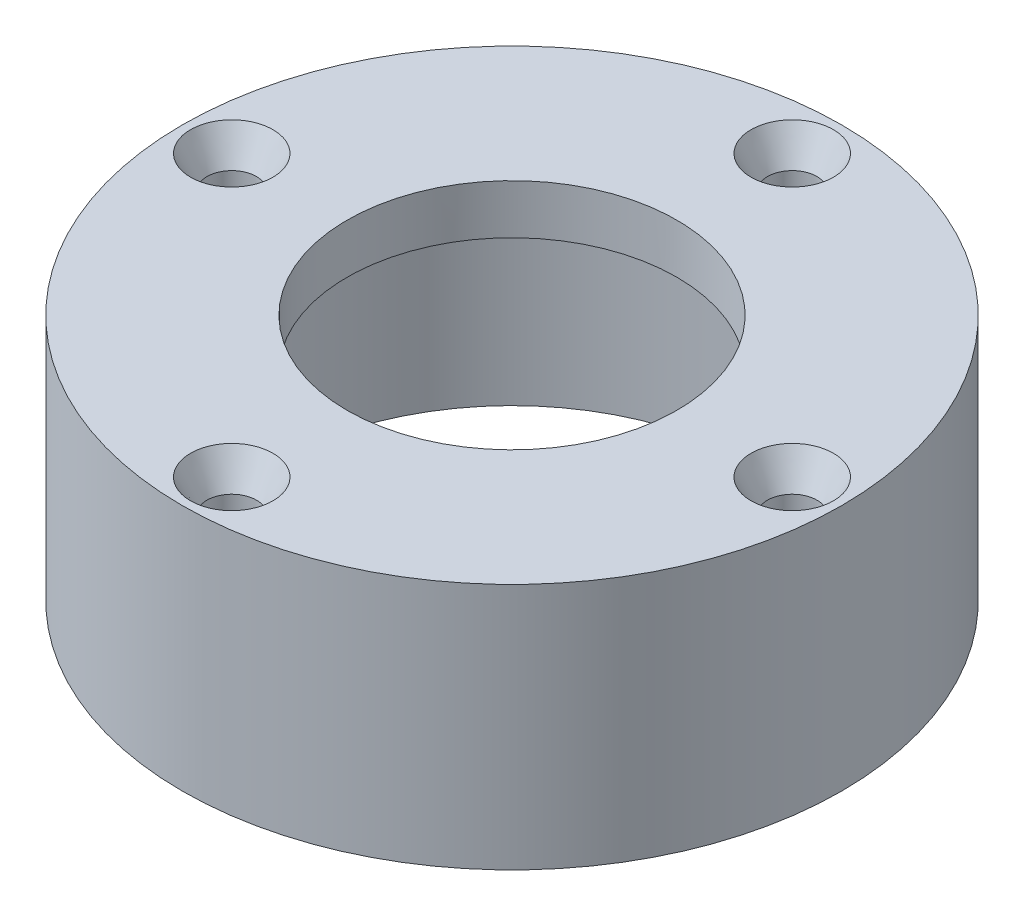
from build123d import *

# Parameters (mm, degrees)
SKETCH1_R                    = 20
BOSS_EXTRUDE1_DEPTH          = 15
SKETCH4_R                    = 14.5
CUT_EXTRUDE3_DEPTH           = 12
SKETCH5_R                    = 10
CUT_EXTRUDE4_DEPTH           = 12
SKETCH6_R                    = 1.5
CUT_EXTRUDE5_DEPTH           = 33.015621187
SKETCH7_R                    = 2.5
CUT_EXTRUDE7_DEPTH           = 2
CUT_EXTRUDE7_DRAFT           = -27
CUT_EXTRUDE7_PROFILE_2_DEPTH = 2
CUT_EXTRUDE7_PROFILE_2_DRAFT = -27
CUT_EXTRUDE7_PROFILE_3_DEPTH = 2
CUT_EXTRUDE7_PROFILE_3_DRAFT = -27
CUT_EXTRUDE7_PROFILE_4_DEPTH = 2
CUT_EXTRUDE7_PROFILE_4_DRAFT = -27


with BuildPart() as part:
    # Sketch1 → Boss-Extrude1 (new body)
    with BuildSketch(Plane(origin=(0, 0, 0), x_dir=(1, 0, 0), z_dir=(0, 1, 0))):
        Circle(SKETCH1_R)
    extrude(amount=BOSS_EXTRUDE1_DEPTH)

    # Sketch4 → Cut-Extrude3 (cut)
    with BuildSketch(Plane.XZ):
        Circle(SKETCH4_R)
    extrude(amount=-CUT_EXTRUDE3_DEPTH, mode=Mode.SUBTRACT)

    # Sketch5 → Cut-Extrude4 (cut)
    with BuildSketch(Plane(origin=(0, 15, 0), x_dir=(1, 0, 0), z_dir=(0, 1, 0))):
        Circle(SKETCH5_R)
    extrude(amount=-CUT_EXTRUDE4_DEPTH, mode=Mode.SUBTRACT)

    # Sketch6 → Cut-Extrude5 (cut, through all)
    with BuildSketch(Plane(origin=(0, 15, 0), x_dir=(1, 0, 0), z_dir=(0, 1, 0))):
        with Locations((0, 17)):
            Circle(SKETCH6_R)
        with Locations((17, 0)):
            Circle(SKETCH6_R)
        with Locations((0, -17)):
            Circle(SKETCH6_R)
        with Locations((-17, 0)):
            Circle(SKETCH6_R)
    extrude(amount=-CUT_EXTRUDE5_DEPTH, mode=Mode.SUBTRACT)


with BuildPart() as cut_extrude7_tool:
    # Sketch7 → Cut-Extrude7 (with draft: the straight prism first)
    with BuildSketch(Plane(origin=(0, 15, 0), x_dir=(1, 0, 0), z_dir=(0, 1, 0))):
        with Locations((0, 17)):
            Circle(SKETCH7_R)
    extrude(amount=-CUT_EXTRUDE7_DEPTH)
    # Cut-Extrude7: the draft: its side faces are tilted about the plane it starts from
    cut_extrude7_sides = [cut_extrude7_tool.faces().sort_by_distance(p)[0] for p in [
        (-2.5, 14, -17),
    ]]
    draft(cut_extrude7_sides, Plane(origin=(0, 15, 0), x_dir=(1, 0, 0), z_dir=(0, 1, 0)), CUT_EXTRUDE7_DRAFT)


with BuildPart() as part_1:
    add(part.part)

    # Cut-Extrude7: cut by cut_extrude7_tool
    add(cut_extrude7_tool.part, mode=Mode.SUBTRACT)


with BuildPart() as cut_extrude7_profile_2_tool:
    # Sketch7 → Cut-Extrude7 profile 2 (with draft: the straight prism first)
    with BuildSketch(Plane(origin=(0, 15, 0), x_dir=(1, 0, 0), z_dir=(0, 1, 0))):
        with Locations((17, 0)):
            Circle(SKETCH7_R)
    extrude(amount=-CUT_EXTRUDE7_PROFILE_2_DEPTH)
    # Cut-Extrude7 profile 2: the draft: its side faces are tilted about the plane it starts from
    cut_extrude7_profile_2_sides = [cut_extrude7_profile_2_tool.faces().sort_by_distance(p)[0] for p in [
        (14.5, 14, 0),
    ]]
    draft(cut_extrude7_profile_2_sides, Plane(origin=(0, 15, 0), x_dir=(1, 0, 0), z_dir=(0, 1, 0)), CUT_EXTRUDE7_PROFILE_2_DRAFT)


with BuildPart() as part_2:
    add(part_1.part)

    # Cut-Extrude7 profile 2: cut by cut_extrude7_profile_2_tool
    add(cut_extrude7_profile_2_tool.part, mode=Mode.SUBTRACT)


with BuildPart() as cut_extrude7_profile_3_tool:
    # Sketch7 → Cut-Extrude7 profile 3 (with draft: the straight prism first)
    with BuildSketch(Plane(origin=(0, 15, 0), x_dir=(1, 0, 0), z_dir=(0, 1, 0))):
        with Locations((0, -17)):
            Circle(SKETCH7_R)
    extrude(amount=-CUT_EXTRUDE7_PROFILE_3_DEPTH)
    # Cut-Extrude7 profile 3: the draft: its side faces are tilted about the plane it starts from
    cut_extrude7_profile_3_sides = [cut_extrude7_profile_3_tool.faces().sort_by_distance(p)[0] for p in [
        (-2.5, 14, 17),
    ]]
    draft(cut_extrude7_profile_3_sides, Plane(origin=(0, 15, 0), x_dir=(1, 0, 0), z_dir=(0, 1, 0)), CUT_EXTRUDE7_PROFILE_3_DRAFT)


with BuildPart() as part_3:
    add(part_2.part)

    # Cut-Extrude7 profile 3: cut by cut_extrude7_profile_3_tool
    add(cut_extrude7_profile_3_tool.part, mode=Mode.SUBTRACT)


with BuildPart() as cut_extrude7_profile_4_tool:
    # Sketch7 → Cut-Extrude7 profile 4 (with draft: the straight prism first)
    with BuildSketch(Plane(origin=(0, 15, 0), x_dir=(1, 0, 0), z_dir=(0, 1, 0))):
        with Locations((-17, 0)):
            Circle(SKETCH7_R)
    extrude(amount=-CUT_EXTRUDE7_PROFILE_4_DEPTH)
    # Cut-Extrude7 profile 4: the draft: its side faces are tilted about the plane it starts from
    cut_extrude7_profile_4_sides = [cut_extrude7_profile_4_tool.faces().sort_by_distance(p)[0] for p in [
        (-19.5, 14, 0),
    ]]
    draft(cut_extrude7_profile_4_sides, Plane(origin=(0, 15, 0), x_dir=(1, 0, 0), z_dir=(0, 1, 0)), CUT_EXTRUDE7_PROFILE_4_DRAFT)


with BuildPart() as part_4:
    add(part_3.part)

    # Cut-Extrude7 profile 4: cut by cut_extrude7_profile_4_tool
    add(cut_extrude7_profile_4_tool.part, mode=Mode.SUBTRACT)


solid = part_4.part
